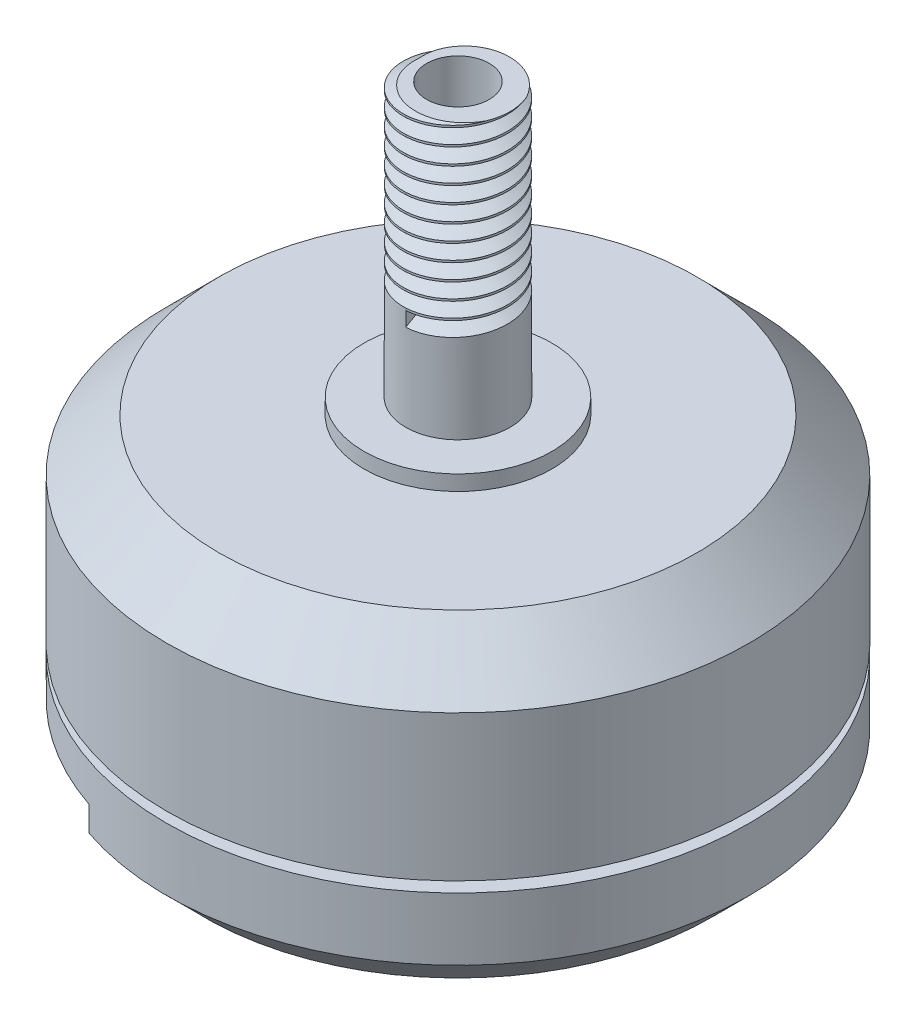
from build123d import *

# Parameters (mm, degrees)
SKETCH1_R           = 13.95
BOSS_EXTRUDE1_DEPTH = 4.8
SKETCH2_R           = 5
BOSS_EXTRUDE2_DEPTH = 0.5
SKETCH3_R           = 13.95
BOSS_EXTRUDE3_DEPTH = 9.47
SKETCH4_R           = 4.5
BOSS_EXTRUDE4_DEPTH = 0.73
SKETCH5_R           = 2.5
BOSS_EXTRUDE5_DEPTH = 13.1
SKETCH6_R           = 1.5
CUT_EXTRUDE1_DEPTH  = 13.83
CUT_SWEEP1_PITCH    = 0.8
SKETCH9_R           = 1.5
CUT_EXTRUDE2_DEPTH  = 2.7
CUT_EXTRUDE3_DEPTH  = 3
SKETCH11_R          = 4
BOSS_EXTRUDE6_DEPTH = 0.5
SKETCH12_R          = 2
BOSS_EXTRUDE7_DEPTH = 2
FILLET1_R           = 2
CHAMFER1_SIZE       = 1.8
CHAMFER2_SIZE       = 2.5


with BuildPart() as part:
    # Sketch1 → Boss-Extrude1 (new body)
    with BuildSketch(Plane(origin=(0, 0, 0), x_dir=(1, 0, 0), z_dir=(0, 1, 0))):
        with Locations(Location((0, 0, 0), (0, 0, 270))):
            Circle(SKETCH1_R)
    extrude(amount=BOSS_EXTRUDE1_DEPTH)

    # Sketch2 → Boss-Extrude2 (add)
    with BuildSketch(Plane(origin=(0, 4.8, 0), x_dir=(1, 0, 0), z_dir=(0, 1, 0))):
        with Locations(Location((0, 0, 0), (0, 0, 270))):
            Circle(SKETCH2_R)
    extrude(amount=BOSS_EXTRUDE2_DEPTH)

    # Sketch9 → Cut-Extrude2 (cut)
    with BuildSketch(Plane.XZ):
        with Locations(Location((0, 8, 0), (0, 0, 270))):
            Circle(SKETCH9_R)
        with Locations(Location((0, -8, 0), (0, 0, 270))):
            Circle(SKETCH9_R)
        with Locations(Location((9.5, 0, 0), (0, 0, 270))):
            Circle(SKETCH9_R)
        with Locations(Location((-9.5, 0, 0), (0, 0, 270))):
            Circle(SKETCH9_R)
    extrude(amount=-CUT_EXTRUDE2_DEPTH, mode=Mode.SUBTRACT)

    # Sketch10 → Cut-Extrude3 (cut)
    with BuildSketch(Plane.XZ):
        with BuildLine():
            Line((-13.221195105, 4.45), (-6.648120035, 4.45))
            ThreePointArc((-6.648120035, 4.45), (-5.656854249, 5.656854249), (-4.45, 6.648120035))
            Line((-4.45, 6.648120035), (-4.45, 13.221195105))
            ThreePointArc((-4.45, 13.221195105), (-9.864139598, 9.864139598), (-13.221195105, 4.45))
        make_face()
    extrude(amount=-CUT_EXTRUDE3_DEPTH, mode=Mode.SUBTRACT)

    # Chamfer1
    chamfer1_edges = [part.edges().sort_by_distance(p)[0] for p in [
        (8.140178131, 0, -11.328724553),
    ]]
    chamfer(chamfer1_edges, length=CHAMFER1_SIZE)


with BuildPart() as body_2:
    # Sketch3 → Boss-Extrude3 (new body)
    with BuildSketch(Plane(origin=(0, 5.3, 0), x_dir=(1, 0, 0), z_dir=(0, 1, 0))):
        with Locations(Location((0, 0, 0), (0, 0, 270))):
            Circle(SKETCH3_R)
    extrude(amount=BOSS_EXTRUDE3_DEPTH)

    # Chamfer2
    chamfer2_edges = [body_2.edges().sort_by_distance(p)[0] for p in [
        (0, 14.77, -13.95),
    ]]
    chamfer(chamfer2_edges, length=CHAMFER2_SIZE)


with BuildPart() as body_3:
    # Sketch4 → Boss-Extrude4 (new body)
    with BuildSketch(Plane(origin=(0, 14.77, 0), x_dir=(1, 0, 0), z_dir=(0, 1, 0))):
        with Locations(Location((0, 0, 0), (0, 0, 270))):
            Circle(SKETCH4_R)
    extrude(amount=BOSS_EXTRUDE4_DEPTH)

    # Sketch5 → Boss-Extrude5 (add)
    with BuildSketch(Plane(origin=(0, 15.5, 0), x_dir=(1, 0, 0), z_dir=(0, 1, 0))):
        with Locations(Location((0, 0, 0), (0, 0, 270))):
            Circle(SKETCH5_R)
    extrude(amount=BOSS_EXTRUDE5_DEPTH)

    # Sketch6 → Cut-Extrude1 (cut)
    with BuildSketch(Plane(origin=(0, 28.6, 0), x_dir=(1, 0, 0), z_dir=(0, 1, 0))):
        with Locations(Location((0, 0, 0), (0, 0, 270))):
            Circle(SKETCH6_R)
    extrude(amount=-CUT_EXTRUDE1_DEPTH, mode=Mode.SUBTRACT)

    # Cut-Sweep1: arcs per turn and ends read off the stored shape
    # Cut-Sweep1: the profile of Sketch8 profile screwed along a right-hand helix through 11.75 turns, 8 arcs to a turn; built about Z, then put on its axis
    cut_sweep1_z = Axis((0, 0, 0), (0, 0, 1))
    cut_sweep1_corners = [(2.5003, 0, -1.150173205), (2.5003, 0, -0.449826795), (1.893782217, 0, -0.8)]
    with BuildLine(mode=Mode.PRIVATE) as cut_sweep1_profile:
        Line(cut_sweep1_corners[0], cut_sweep1_corners[1])
        Line(cut_sweep1_corners[1], cut_sweep1_corners[2])
        Line(cut_sweep1_corners[2], cut_sweep1_corners[0])
    cut_sweep1_cap = Face(cut_sweep1_profile.wire())
    cut_sweep1_turn_angles = [0, 22.5, 45, 67.5, 90, 112.5, 135, 157.5, 180, 202.5, 225, 247.5, 270, 292.5, 315, 337.5, 360]
    cut_sweep1_turn_weights = [1, 0.9238795325112867, 1, 0.9238795325112867, 1, 0.9238795325112867, 1, 0.9238795325112867, 1, 0.9238795325112867, 1, 0.9238795325112867, 1, 0.9238795325112867, 1, 0.9238795325112867, 1]
    cut_sweep1_turn_rails = [Edge.make_bspline([Vector(p[0], p[1], 0).rotate(cut_sweep1_z, cut_sweep1_turn_angles[k]) / cut_sweep1_turn_weights[k] + Vector(0, 0, p[2] + CUT_SWEEP1_PITCH * cut_sweep1_turn_angles[k] / 360) for k in range(17)], [0, 0, 0, 1, 1, 2, 2, 3, 3, 4, 4, 5, 5, 6, 6, 7, 7, 8, 8, 8], 2, cut_sweep1_turn_weights) for p in cut_sweep1_corners]
    cut_sweep1_turn_sides = [Face.make_surface_from_curves(cut_sweep1_turn_rails[p[0]], cut_sweep1_turn_rails[p[1]]) for p in [(0, 1), (1, 2), (2, 0)]]
    cut_sweep1_last_angles = [3960, 3982.5, 4005, 4027.5, 4050, 4072.5, 4095, 4117.5, 4140, 4162.5, 4185, 4207.5, 4230]
    cut_sweep1_last_weights = [1, 0.9238795325112867, 1, 0.9238795325112867, 1, 0.9238795325112867, 1, 0.9238795325112867, 1, 0.9238795325112867, 1, 0.9238795325112867, 1]
    cut_sweep1_last_rails = [Edge.make_bspline([Vector(p[0], p[1], 0).rotate(cut_sweep1_z, cut_sweep1_last_angles[k]) / cut_sweep1_last_weights[k] + Vector(0, 0, p[2] + CUT_SWEEP1_PITCH * cut_sweep1_last_angles[k] / 360) for k in range(13)], [0, 0, 0, 1, 1, 2, 2, 3, 3, 4, 4, 5, 5, 6, 6, 6], 2, cut_sweep1_last_weights) for p in cut_sweep1_corners]
    cut_sweep1_last_sides = [Face.make_surface_from_curves(cut_sweep1_last_rails[p[0]], cut_sweep1_last_rails[p[1]]) for p in [(0, 1), (1, 2), (2, 0)]]
    cut_sweep1 = Plane(origin=(0, 28.6, 0), x_dir=(-1, 0, 0), z_dir=(0, -1, 0)) * Solid(Shell([*[p.moved(Location((0, 0, CUT_SWEEP1_PITCH * i))) for i in range(11) for p in cut_sweep1_turn_sides], *cut_sweep1_last_sides, cut_sweep1_cap, cut_sweep1_cap.rotate(cut_sweep1_z, 4230).moved(Location((0, 0, CUT_SWEEP1_PITCH * 4230 / 360)))]))
    add(cut_sweep1, mode=Mode.SUBTRACT)


with BuildPart() as body_4:
    # Sketch11 → Boss-Extrude6 (new body)
    with BuildSketch(Plane.XZ):
        with Locations(Location((0, 0, 0), (0, 0, 270))):
            Circle(SKETCH11_R)
    extrude(amount=BOSS_EXTRUDE6_DEPTH)

    # Sketch12 → Boss-Extrude7 (add)
    with BuildSketch(Plane.XZ.offset(0.5)):
        with Locations(Location((0, 0, 0), (0, 0, 270))):
            Circle(SKETCH12_R)
    extrude(amount=BOSS_EXTRUDE7_DEPTH)

    # Fillet1
    fillet1_edges = [body_4.edges().sort_by_distance(p)[0] for p in [
        (0, -2.5, 2),
    ]]
    fillet(fillet1_edges, radius=FILLET1_R - 0.0001)  # a hair under: the kernel refuses the full size


solid = Compound([part.part, body_2.part, body_3.part, body_4.part])
